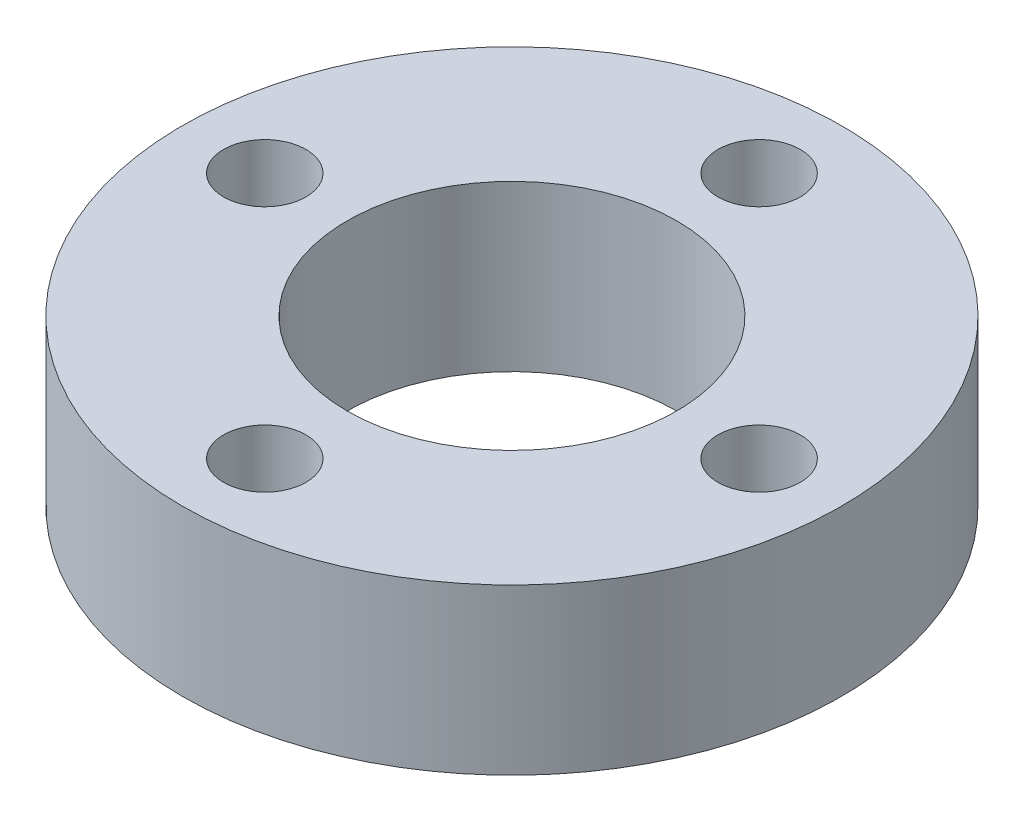
from build123d import *

# Parameters (mm, degrees)
SKETCH1_R             = 10
BOSS_EXTRUDE1_DEPTH   = 5
SKETCH2_R             = 5
CUT_EXTRUDE1_DEPTH    = 16
SKETCH3_R             = 1.25
CUT_EXTRUDE2_DEPTH    = 5
CIRPATTERN1_OUTLINE_R = 1.25
CIRPATTERN1_DEPTH     = 5


# Read off the part's stored shape, not the designer's step: CirPattern1
with BuildPart() as part:
    # Sketch1 → Boss-Extrude1 (new body)
    with BuildSketch(Plane(origin=(0, 0, 0), x_dir=(1, 0, 0), z_dir=(0, 1, 0))):
        with Locations(Location((0, 0, 0), (0, 0, 270))):
            Circle(SKETCH1_R)
    extrude(amount=BOSS_EXTRUDE1_DEPTH)

    # Sketch2 → Cut-Extrude1 (cut, through all)
    with BuildSketch(Plane(origin=(0, 0, 0), x_dir=(1, 0, 0), z_dir=(0, 1, 0))):
        with Locations(Location((0, 0, 0), (0, 0, 270))):
            Circle(SKETCH2_R)
    extrude(amount=CUT_EXTRUDE1_DEPTH, mode=Mode.SUBTRACT)

    # Sketch3 → Cut-Extrude2 (cut)
    with BuildSketch(Plane(origin=(0, 5, 0), x_dir=(1, 0, 0), z_dir=(0, 1, 0))):
        with Locations(Location((-7.5, 0, 0), (0, 0, 270))):
            Circle(SKETCH3_R)
    extrude(amount=-CUT_EXTRUDE2_DEPTH, mode=Mode.SUBTRACT)

    # CirPattern1 outline → CirPattern1 (cut)
    with BuildSketch(Plane(origin=(0, 0, 0), x_dir=(1, 0, 0), z_dir=(0, 1, 0))):
        with Locations((0, 7.5)):
            Circle(CIRPATTERN1_OUTLINE_R)
        with Locations((7.5, 0)):
            Circle(CIRPATTERN1_OUTLINE_R)
        with Locations((0, -7.5)):
            Circle(CIRPATTERN1_OUTLINE_R)
    extrude(amount=CIRPATTERN1_DEPTH, mode=Mode.SUBTRACT)


solid = part.part
